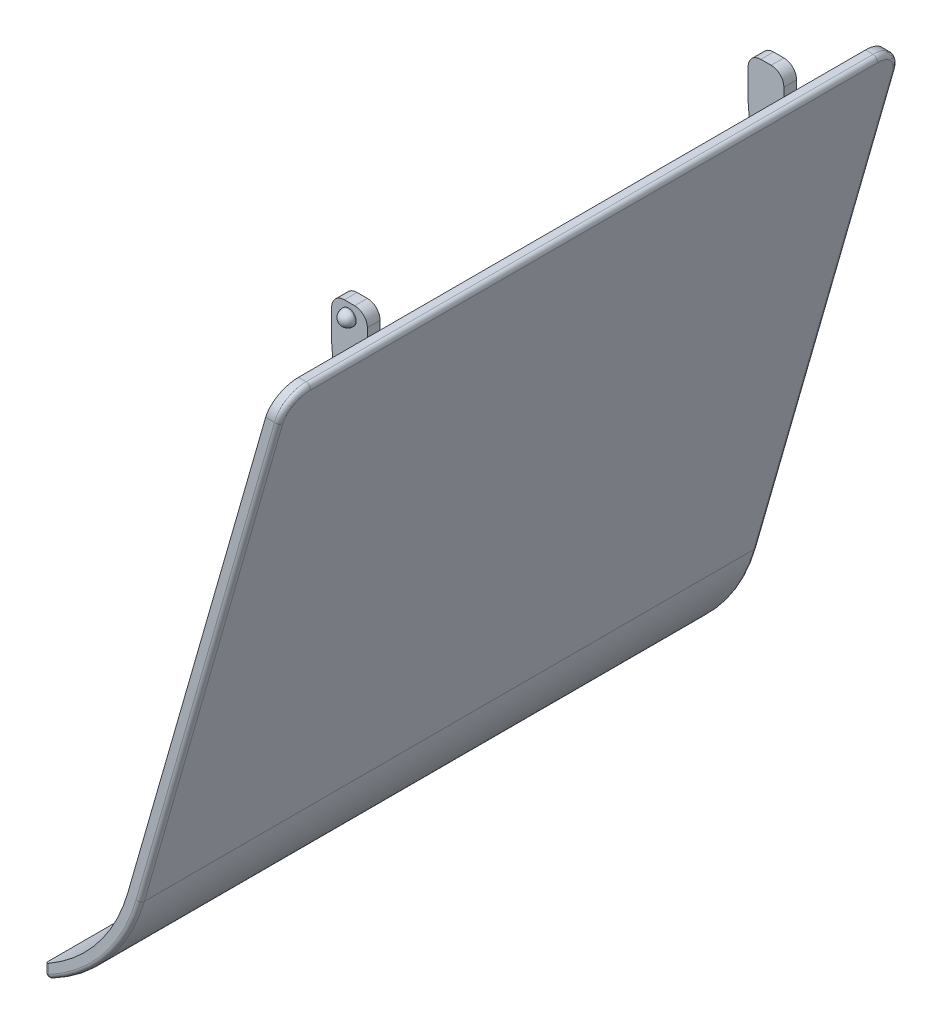
from build123d import *

# Parameters (mm, degrees)
BOSS_EXTRUDE1_DEPTH   = 36.425
CUT_EXTRUDE1_DEPTH    = 110.090212662
CUT_EXTRUDE2_DEPTH    = 109.098783751
FILLET1_R             = 3
BOSS_EXTRUDE12_REACH  = 92.552
BOSS_EXTRUDE12_START  = -4.21
SKETCH27_W            = 1.5
SKETCH27_H            = 5
CUT_EXTRUDE9_REACH    = 101.691
SKETCH30_W            = 0.716863464
SKETCH30_H            = 2.5
SKETCH31_R            = 0.9
BOSS_EXTRUDE13_DEPTH  = 1
FILLET9_R             = 1.5
FILLET10_R            = 1.5
FILLET11_R            = 0.9
FILLET9_OF_MIRROR4_R  = 1.5
FILLET10_OF_MIRROR4_R = 1.5
FILLET11_OF_MIRROR4_R = 0.9
FILLET12_R            = 0.5


with BuildPart() as part:
    # Sketch1 → Boss-Extrude1 (new, symmetric)
    with BuildSketch(Plane.XY):
        with BuildLine():
            Line((0, 0), (-17.110884891, -59.672747116))
            ThreePointArc((-17.110884891, -59.672747116), (-22.347799076, -68.454296451), (-31.240591359, -73.5))
            Line((-31.240591359, -73.5), (-30.858426801, -74.9505))
            ThreePointArc((-30.858426801, -74.9505), (-21.298675096, -69.526368685), (-15.668992347, -60.08620315))
            Line((-15.668992347, -60.08620315), (1.441892544, -0.413456034))
            Line((1.441892544, -0.413456034), (1.560449154, 0))
            Line((1.560449154, 0), (0, 0))
        make_face()
    extrude(amount=BOSS_EXTRUDE1_DEPTH, both=True)

    # Sketch2 → Cut-Extrude1 (cut, through all)
    with BuildSketch(Plane.XY.offset(36.425)):
        with BuildLine():
            Line((-31.240591359, -73.5), (-26.943866684, -73.5))
            ThreePointArc((-26.943866684, -73.5), (-28.865857957, -74.320486174), (-30.858426801, -74.9505))
            Line((-30.858426801, -74.9505), (-31.240591359, -73.5))
        make_face()
    extrude(amount=-CUT_EXTRUDE1_DEPTH, mode=Mode.SUBTRACT)

    # Sketch3 → Cut-Extrude2 (cut, through all)
    with BuildSketch(Plane.XY.offset(36.425)):
        with BuildLine():
            Line((-26.943866684, -73.5), (-31.240591359, -73.5))
            ThreePointArc((-31.240591359, -73.5), (-29.043541661, -72.783058785), (-26.943866684, -71.817451685))
            Line((-26.943866684, -71.817451685), (-26.943866684, -73.5))
        make_face()
    extrude(amount=-CUT_EXTRUDE2_DEPTH, mode=Mode.SUBTRACT)

    # Fillet1
    fillet1_edges = [part.edges().sort_by_distance(p)[0] for p in [
        (0.780224577, 0, 36.425),
        (0.780224577, 0, -36.425),
    ]]
    fillet(fillet1_edges, radius=FILLET1_R)

    # Boss-Extrude12: up to this plane
    boss_extrude12_end = Plane(origin=(0, 0, 36.425), z_dir=(0.9612616959383179, -0.2756373558170027, 0))
    # Sketch27 → Boss-Extrude12 (add, up to the surface)
    with BuildSketch(Plane(origin=(0, 0, 0), x_dir=(0, 0, -1), z_dir=(1, 0, 0)).offset(BOSS_EXTRUDE12_START), mode=Mode.PRIVATE) as boss_extrude12_sk1:
        with Locations((-24.55, 0)):
            Rectangle(SKETCH27_W, SKETCH27_H)
    boss_extrude12_tool1 = split(extrude(boss_extrude12_sk1.sketch, amount=BOSS_EXTRUDE12_REACH, mode=Mode.PRIVATE), bisect_by=boss_extrude12_end, keep=Keep.BOTH, mode=Mode.PRIVATE)
    boss_extrude12 = boss_extrude12_tool1.solids().sort_by_distance((-4.21, 0, 24.55))[0]
    add(boss_extrude12)

    # Sketch30 → Cut-Extrude9 (cut, up to next)
    with BuildSketch(Plane.XY.offset(25.3), mode=Mode.PRIVATE) as cut_extrude9_sk1:
        with Locations((0.358431732, 1.25)):
            Rectangle(SKETCH30_W, SKETCH30_H)
    cut_extrude9_tool1 = extrude(cut_extrude9_sk1.sketch, amount=-CUT_EXTRUDE9_REACH, mode=Mode.PRIVATE) & part.part
    cut_extrude9 = cut_extrude9_tool1.solids().sort_by_distance((0.358432, 1.25, 25.3))[0]
    add(cut_extrude9, mode=Mode.SUBTRACT)

    # Sketch31 → Boss-Extrude13 (add)
    with BuildSketch(Plane.XY.offset(25.3)):
        with Locations(Location((-2.21, 1, 0), (0, 0, 180))):
            Circle(SKETCH31_R)
    boss_extrude13 = extrude(amount=BOSS_EXTRUDE13_DEPTH)

    # Fillet9
    fillet9_edges = [part.edges().sort_by_distance(p)[0] for p in [
        (-4.21, 2.5, 24.55),
    ]]
    fillet(fillet9_edges, radius=FILLET9_R)

    # Fillet10
    fillet10_edges = [part.edges().sort_by_distance(p)[0] for p in [
        (0, 2.5, 24.55),
    ]]
    fillet(fillet10_edges, radius=FILLET10_R)

    # Fillet11
    fillet11_edges = [part.edges().sort_by_distance(p)[0] for p in [
        (-1.31, 1, 26.3),
    ]]
    fillet(fillet11_edges, radius=FILLET11_R)

    # Mirror4: Boss-Extrude12, Cut-Extrude9, Boss-Extrude13 across plane
    add(boss_extrude12.mirror(Plane.XY))
    add(cut_extrude9.mirror(Plane.XY), mode=Mode.SUBTRACT)
    add(boss_extrude13.mirror(Plane.XY))

    # Fillet9 of Mirror4
    fillet9_of_mirror4_edges = [part.edges().sort_by_distance(p)[0] for p in [
        (-4.21, 2.5, -24.55),
    ]]
    fillet(fillet9_of_mirror4_edges, radius=FILLET9_OF_MIRROR4_R)

    # Fillet10 of Mirror4
    fillet10_of_mirror4_edges = [part.edges().sort_by_distance(p)[0] for p in [
        (0, 2.5, -24.55),
    ]]
    fillet(fillet10_of_mirror4_edges, radius=FILLET10_OF_MIRROR4_R)

    # Fillet11 of Mirror4
    fillet11_of_mirror4_edges = [part.edges().sort_by_distance(p)[0] for p in [
        (-1.31, 1, -26.3),
    ]]
    fillet(fillet11_of_mirror4_edges, radius=FILLET11_OF_MIRROR4_R)

    # Fillet12
    fillet12_edges = [part.edges().sort_by_distance(p)[0] for p in [
        (-7.484389675, -31.543101575, 36.425),
        (-19.877867178, -67.993869785, -36.425),
        (-19.877867178, -67.993869785, 36.425),
        (-26.943866684, -73.5, 0),
        (-26.943866684, -72.658725842, -36.425),
        (-26.943866684, -72.658725842, 36.425),
        (1.560449154, 0, 0),
        (1.302457732, -0.899723012, 35.567156991),
        (1.302457732, -0.899723012, -35.567156991),
        (-7.484389675, -31.543101575, -36.425),
    ]]
    fillet(fillet12_edges, radius=FILLET12_R)

    # Chamfer1
    # the kernel refuses this chamfer: 10, 3.5 mm, written as the material it adds along each edge
    with BuildSketch(Plane(origin=(-0.716863464, -2.5, 25.3), x_dir=(-0.26268080042718955, -0.9648827892997839, 0), z_dir=(0, 0, -1))) as chamfer1_piece_1_section:
        with BuildLine():
            Line((10.375794366, 0), (0.542683512, 3.511617253))
            Line((0.542683512, 3.511617253), (0.349706955, 3.564153413))
            ThreePointArc((0.349706955, 3.564153413), (0.270766903, 1.755965125), (-0.192976558, 0.05253616))
            Line((-0.192976558, 0.05253616), (0.00269055, -0.199981902))
            ThreePointArc((0.00269055, -0.199981902), (5.189648845, -0.130196738), (10.378484916, -0.199981902))
            Line((10.378484916, -0.199981902), (10.375794366, 0))
        make_face()
    chamfer1_piece_1 = extrude(amount=1.5, mode=Mode.PRIVATE)
    chamfer1_piece_1 = split(chamfer1_piece_1, bisect_by=Plane(origin=(-4.21, -5.808119571, 24.55), z_dir=(1, 0, 0)), keep=Keep.TOP, mode=Mode.PRIVATE)
    add(chamfer1_piece_1)
    with BuildSketch(Plane(origin=(-0.716863464, -2.5, -25.3), x_dir=(-0.26268080042718955, -0.9648827892997839, 0), z_dir=(0, 0, 1))) as chamfer1_piece_2_section:
        with BuildLine():
            Line((10.375794366, 0), (0.542683512, -3.511617253))
            Line((0.542683512, -3.511617253), (0.349706955, -3.564153413))
            ThreePointArc((0.349706955, -3.564153413), (0.270766903, -1.755965125), (-0.192976558, -0.05253616))
            Line((-0.192976558, -0.05253616), (0.00269055, 0.199981902))
            ThreePointArc((0.00269055, 0.199981902), (5.189648845, 0.130196738), (10.378484916, 0.199981902))
            Line((10.378484916, 0.199981902), (10.375794366, 0))
        make_face()
    chamfer1_piece_2 = extrude(amount=1.5, mode=Mode.PRIVATE)
    chamfer1_piece_2 = split(chamfer1_piece_2, bisect_by=Plane(origin=(-4.21, -5.808119571, -24.55), z_dir=(1, 0, 0)), keep=Keep.TOP, mode=Mode.PRIVATE)
    add(chamfer1_piece_2)


solid = part.part
